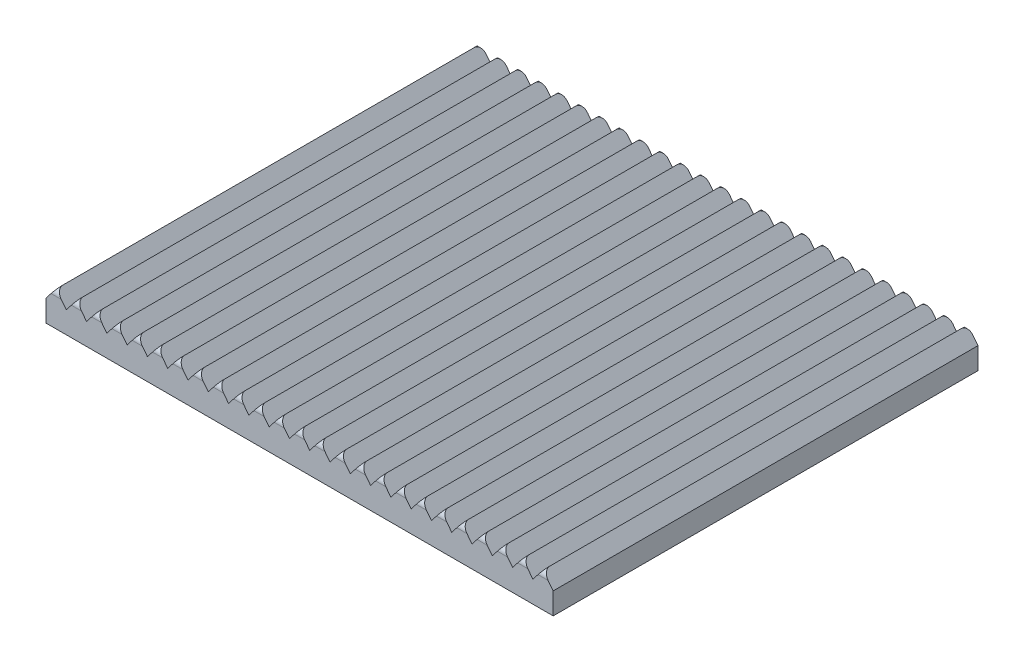
from build123d import *

# Parameters (mm, degrees)
SKETCH1_W           = 58.5
SKETCH1_H           = 49
SKETCH1_R           = 3.1
BOSS_EXTRUDE1_DEPTH = 1.5
BOSS_EXTRUDE2_DEPTH = 49
CUT_EXTRUDE1_DEPTH  = 2
CHAMFER2_SIZE       = 0.2
CUT_EXTRUDE3_DEPTH  = 64.549193543
CHAMFER3_SIZE       = 2


with BuildPart() as part:
    # Sketch1 → Boss-Extrude1 (new body)
    with BuildSketch(Plane(origin=(0, 0, 0), x_dir=(1, 0, 0), z_dir=(0, 1, 0))):
        Rectangle(SKETCH1_W, SKETCH1_H)
        with Locations(Location((0, 0, 0), (0, 0, 270))):
            Circle(SKETCH1_R, mode=Mode.SUBTRACT)
    extrude(amount=BOSS_EXTRUDE1_DEPTH)

    # Sketch2 → Boss-Extrude2 (add)
    with BuildSketch(Plane(origin=(0, 0, -24.5), x_dir=(-1, 0, 0), z_dir=(0, 0, -1))):
        Polygon((-29.25, 1.5), (29.25, 1.5), (29.25, 2.5), (28.08, 4), (26.91, 2.5), (25.74, 4), (24.57, 2.5), (23.4, 4), (22.23, 2.5), (21.06, 4), (19.89, 2.5), (18.72, 4), (17.55, 2.5), (16.38, 4), (15.21, 2.5), (14.04, 4), (12.87, 2.5), (11.7, 4), (10.53, 2.5), (9.36, 4), (8.19, 2.5), (7.02, 4), (5.85, 2.5), (4.68, 4), (3.51, 2.5), (2.34, 4), (1.17, 2.5), (0, 4), (-1.17, 2.5), (-2.34, 4), (-3.51, 2.5), (-4.68, 4), (-5.85, 2.5), (-7.02, 4), (-8.19, 2.5), (-9.36, 4), (-10.53, 2.5), (-11.7, 4), (-12.87, 2.5), (-14.04, 4), (-15.21, 2.5), (-16.38, 4), (-17.55, 2.5), (-18.72, 4), (-19.89, 2.5), (-21.06, 4), (-22.23, 2.5), (-23.4, 4), (-24.57, 2.5), (-25.74, 4), (-26.91, 2.5), (-28.08, 4), (-29.25, 2.5), align=None)
    extrude(amount=-BOSS_EXTRUDE2_DEPTH)

    # Sketch3 → Cut-Extrude1 (cut)
    with BuildSketch(Plane(origin=(0, 0, 0), x_dir=(-1, 0, 0), z_dir=(0, -1, 0))):
        with BuildLine():
            Line((-1.75, -2.558808316), (-1.75, -5))
            Line((-1.75, -5), (1.75, -5))
            Line((1.75, -5), (1.75, -2.558808316))
            ThreePointArc((1.75, -2.558808316), (0, 3.1), (-1.75, -2.558808316))
        make_face()
    extrude(amount=-CUT_EXTRUDE1_DEPTH, mode=Mode.SUBTRACT)

    # Chamfer2
    chamfer2_edges = [part.edges().sort_by_distance(p)[0] for p in [
        (0, 0, -3.1),
    ]]
    chamfer(chamfer2_edges, length=CHAMFER2_SIZE)

    # Sketch4 → Cut-Extrude3 (cut, through all)
    with BuildSketch(Plane(origin=(29.25, 0, 0), x_dir=(0, 0, -1), z_dir=(1, 0, 0))):
        with BuildLine():
            Line((-23.75, 4), (-24.5, 4))
            Line((-24.5, 4), (-24.5, 3.25))
            ThreePointArc((-24.5, 3.25), (-24.280330086, 3.780330086), (-23.75, 4))
        make_face()
    cut_extrude3 = extrude(amount=-CUT_EXTRUDE3_DEPTH, mode=Mode.SUBTRACT)

    # Mirror1: Cut-Extrude3 across plane
    add(cut_extrude3.mirror(Plane.XY), mode=Mode.SUBTRACT)

    # Chamfer3
    chamfer3_edges = [part.edges().sort_by_distance(p)[0] for p in [
        (0, 0, 5),
    ]]
    chamfer(chamfer3_edges, length=CHAMFER3_SIZE - 0.0001)  # a hair under: the kernel refuses the full size


solid = part.part
